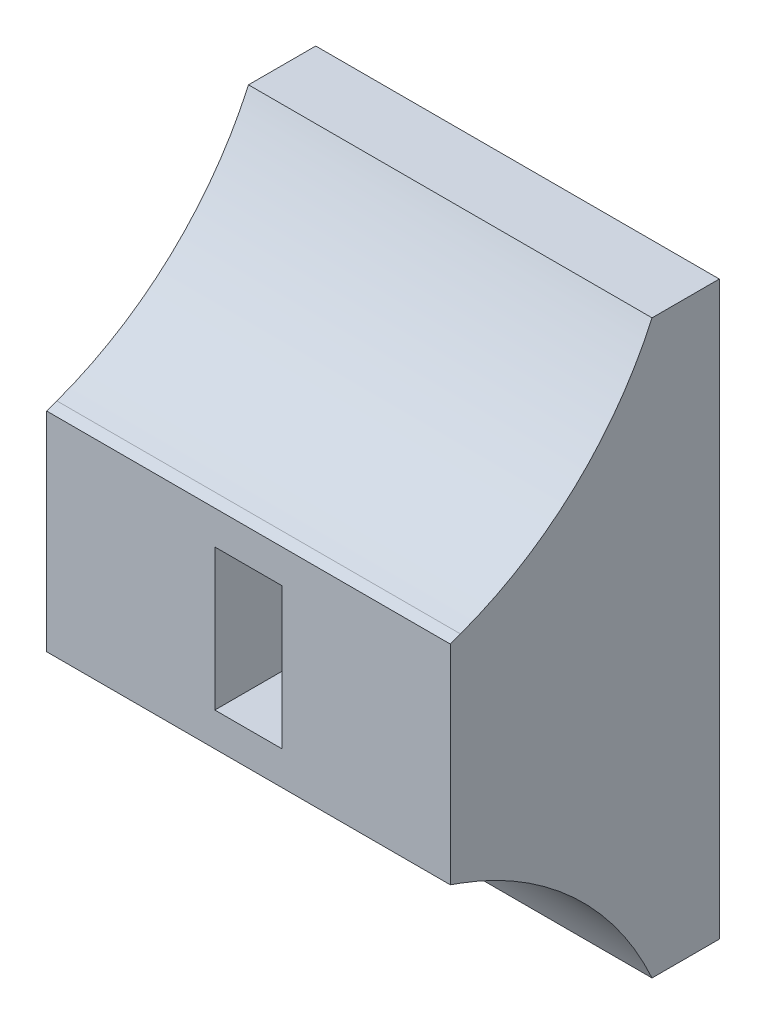
from build123d import *

# Parameters (mm, degrees)
SKETCH1_W      = 12
SKETCH1_H      = 17
SKETCH1_W_2    = 2
SKETCH1_H_2    = 4.2
EXTRUDE1_DEPTH = 8
EXTRUDE2_DEPTH = 17.740669043
FILLET1_R      = 10


with BuildPart() as part:
    # Sketch1 → Extrude1 (new body)
    with BuildSketch(Plane.XY):
        Rectangle(SKETCH1_W, SKETCH1_H)
        Rectangle(SKETCH1_W_2, SKETCH1_H_2, mode=Mode.SUBTRACT)
    extrude(amount=EXTRUDE1_DEPTH)

    # Sketch2 → Extrude2 (cut, through all)
    with BuildSketch(Plane.ZY.offset(6)):
        Polygon((2, 8.5), (3.349347136, 4.792699212), (8, 3.1), (8, 8.5), align=None)
    extrude2 = extrude(amount=-EXTRUDE2_DEPTH, mode=Mode.SUBTRACT)

    # Mirror1: Extrude2 across plane
    add(extrude2.mirror(Plane.ZX), mode=Mode.SUBTRACT)

    # Fillet1
    # the kernel refuses this fillet: 10 mm, written as the material it adds along each edge
    with BuildSketch(Plane(origin=(-6, -4.792699212, 3.349347136), x_dir=(0, -0.9396926207859071, -0.34202014332567254), z_dir=(1, 0, 0))) as fillet1_piece_1:
        with BuildLine():
            CenterArc((4.686139514, -9.972514667), FILLET1_R, 94.249009028, 45.750990972)
            Line((-2.974304917, -3.54463857), (-3.127513806, -3.416081048))
            Line((-3.127513806, -3.416081048), (-0.153208889, 0.128557522))
            Line((-0.153208889, 0.128557522), (0, 0.2))
            ThreePointArc((0, 0.2), (1.972613547, 0.2), (3.930408846, 0.199450293))
            Line((3.930408846, 0.199450293), (3.945227094, 0))
        make_face()
    extrude(amount=12)
    with BuildSketch(Plane(origin=(-6, 4.792699212, 3.349347136), x_dir=(0, 0.9396926207859071, -0.34202014332567254), z_dir=(1, 0, 0))) as fillet1_piece_2:
        with BuildLine():
            CenterArc((4.686139514, 9.972514667), FILLET1_R, 220, 45.750990972)
            Line((-2.974304917, 3.54463857), (-3.127513806, 3.416081048))
            Line((-3.127513806, 3.416081048), (-0.153208889, -0.128557522))
            Line((-0.153208889, -0.128557522), (0, -0.2))
            ThreePointArc((0, -0.2), (1.972613547, -0.2), (3.930408846, -0.199450293))
            Line((3.930408846, -0.199450293), (3.945227094, 0))
        make_face()
    extrude(amount=12)


solid = part.part
